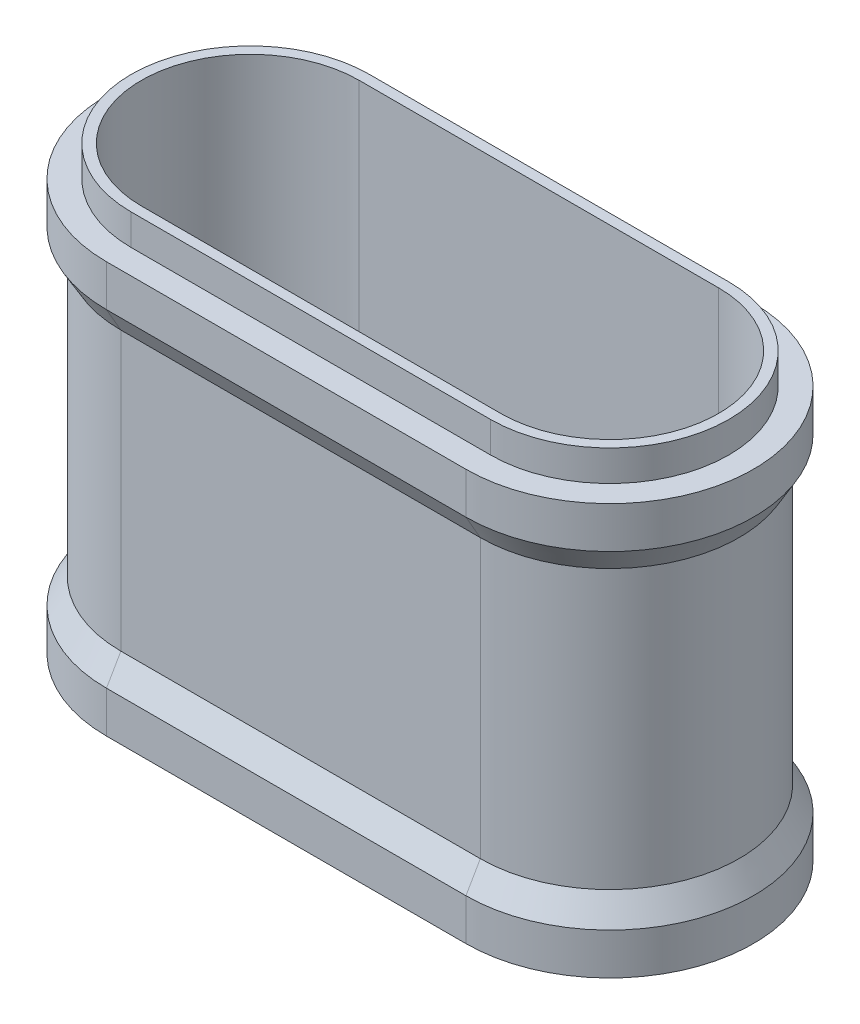
from build123d import *

# Parameters (mm, degrees)
BOSS_EXTRUDE1_DEPTH      = 10
BOSS_EXTRUDE1_DEPTH_BACK = 10
BOSS_EXTRUDE2_START      = -1.5
BOSS_EXTRUDE2_DEPTH      = 1.5
BOSS_EXTRUDE3_DEPTH      = 1.5
CHAMFER1_SIZE            = 1
CHAMFER1_SIZE_2          = 1.732050808


with BuildPart() as part:
    # Sketch1 → Boss-Extrude1 (new, two sides: drawn at the far end of the back side and taken through both)
    with BuildSketch(Plane(origin=(0, 0, 0), x_dir=(1, 0, 0), z_dir=(0, 1, 0)).offset(-BOSS_EXTRUDE1_DEPTH_BACK)):
        with BuildLine():
            Line((-8.75, 6.3), (8.75, 6.3))
            ThreePointArc((8.75, 6.3), (15.05, 0), (8.75, -6.3))
            Line((8.75, -6.3), (-8.75, -6.3))
            ThreePointArc((-8.75, -6.3), (-15.05, 0), (-8.75, 6.3))
        make_face()
        with BuildLine():
            Line((-8.75, 5.3), (8.75, 5.3))
            ThreePointArc((8.75, 5.3), (14.05, 0), (8.75, -5.3))
            Line((8.75, -5.3), (-8.75, -5.3))
            ThreePointArc((-8.75, -5.3), (-14.05, 0), (-8.75, 5.3))
        make_face(mode=Mode.SUBTRACT)
    extrude(amount=BOSS_EXTRUDE1_DEPTH + BOSS_EXTRUDE1_DEPTH_BACK)

    # Sketch2 → Boss-Extrude2 (add)
    with BuildSketch(Plane(origin=(0, 10, 0), x_dir=(1, 0, 0), z_dir=(0, 1, 0)).offset(BOSS_EXTRUDE2_START)):
        with BuildLine():
            Line((8.75, -7), (-8.75, -7))
            ThreePointArc((-8.75, -7), (-15.75, 0), (-8.75, 7))
            Line((-8.75, 7), (8.75, 7))
            ThreePointArc((8.75, 7), (15.75, 0), (8.75, -7))
        make_face()
        with BuildLine():
            Line((-8.75, -5.3), (8.75, -5.3))
            ThreePointArc((8.75, -5.3), (14.05, 0), (8.75, 5.3))
            Line((8.75, 5.3), (-8.75, 5.3))
            ThreePointArc((-8.75, 5.3), (-14.05, 0), (-8.75, -5.3))
        make_face(mode=Mode.SUBTRACT)
    boss_extrude2 = extrude(amount=BOSS_EXTRUDE2_DEPTH)

    # Mirror1: Boss-Extrude2 across plane
    add(boss_extrude2.mirror(Plane.ZX))

    # Sketch3 → Boss-Extrude3 (add)
    with BuildSketch(Plane(origin=(0, 10, 0), x_dir=(1, 0, 0), z_dir=(0, 1, 0))):
        with BuildLine():
            Line((-8.75, -5.8), (8.75, -5.8))
            ThreePointArc((8.75, -5.8), (14.55, 0), (8.75, 5.8))
            Line((8.75, 5.8), (-8.75, 5.8))
            ThreePointArc((-8.75, 5.8), (-14.55, 0), (-8.75, -5.8))
        make_face()
        with BuildLine():
            Line((-8.75, -5.3), (8.75, -5.3))
            ThreePointArc((8.75, -5.3), (14.05, 0), (8.75, 5.3))
            Line((8.75, 5.3), (-8.75, 5.3))
            ThreePointArc((-8.75, 5.3), (-14.05, 0), (-8.75, -5.3))
        make_face(mode=Mode.SUBTRACT)
    extrude(amount=BOSS_EXTRUDE3_DEPTH)

    # Chamfer1
    # the kernel refuses this chamfer: 1.732050808, 1 mm, written as the material it adds along each edge
    with BuildSketch(Plane(origin=(8.75, -8.5, 0), x_dir=(0, 0, -1), z_dir=(-1, 0, 0))) as chamfer1_piece_1_section:
        Polygon((6.3 + CHAMFER1_SIZE, 0), (6.3, -CHAMFER1_SIZE_2), (6.3, 0), align=None)
    chamfer1_piece_1 = revolve(axis=Axis((8.75, -8.5, 0), (0, -1, 0)), revolution_arc=180, mode=Mode.PRIVATE)
    chamfer1_piece_1 = chamfer1_piece_1 & Plane(origin=(8.75, -7.628425911, 0), x_dir=(0, 0, -1), z_dir=(0, 1, 0)) * Cylinder(7, 30, mode=Mode.PRIVATE)
    add(chamfer1_piece_1)
    with BuildSketch(Plane(origin=(8.75, -8.5, -6.3), x_dir=(0, -0.05789386240267147, -0.9983227437537926), z_dir=(-1, 0, 0))) as chamfer1_piece_2_section:
        Polygon((CHAMFER1_SIZE * 0.998322743754, -CHAMFER1_SIZE * 0.0578938624027), (-CHAMFER1_SIZE_2 * 0.0578938623883, -CHAMFER1_SIZE_2 * 0.998322743505), (0, 0), align=None)
    chamfer1_piece_2 = extrude(amount=17.5, mode=Mode.PRIVATE)
    chamfer1_piece_2 = split(chamfer1_piece_2, bisect_by=Plane(origin=(1.34e-07, -7.886810156, -7), z_dir=(0, 0, 1)), keep=Keep.TOP, mode=Mode.PRIVATE)
    add(chamfer1_piece_2)
    with BuildSketch(Plane(origin=(-8.75, -8.5, 6.3), x_dir=(0, -0.05789386240267147, 0.9983227437537926), z_dir=(1, 0, 0))) as chamfer1_piece_3_section:
        Polygon((CHAMFER1_SIZE * 0.998322743754, -CHAMFER1_SIZE * 0.0578938624027), (-CHAMFER1_SIZE_2 * 0.0578938623883, -CHAMFER1_SIZE_2 * 0.998322743505), (0, 0), align=None)
    chamfer1_piece_3 = extrude(amount=17.5, mode=Mode.PRIVATE)
    chamfer1_piece_3 = split(chamfer1_piece_3, bisect_by=Plane(origin=(-1.34e-07, -7.886810156, 7), z_dir=(0, 0, -1)), keep=Keep.TOP, mode=Mode.PRIVATE)
    add(chamfer1_piece_3)
    with BuildSketch(Plane(origin=(-8.75, -8.5, 0), x_dir=(0, 0, 1), z_dir=(1, 0, 0))) as chamfer1_piece_4_section:
        Polygon((6.3 + CHAMFER1_SIZE, 0), (6.3, -CHAMFER1_SIZE_2), (6.3, 0), align=None)
    chamfer1_piece_4 = revolve(axis=Axis((-8.75, -8.5, 0), (0, -1, 0)), revolution_arc=180, mode=Mode.PRIVATE)
    chamfer1_piece_4 = chamfer1_piece_4 & Plane(origin=(-8.75, -7.628425911, 0), x_dir=(0, 0, 1), z_dir=(0, 1, 0)) * Cylinder(7, 30, mode=Mode.PRIVATE)
    add(chamfer1_piece_4)
    with BuildSketch(Plane(origin=(8.75, 8.5, -6.3), x_dir=(0, -0.9998132206222079, 0.01932676561270069), z_dir=(-1, 0, 0))) as chamfer1_piece_5_section:
        Polygon((CHAMFER1_SIZE_2 * 0.999813220373, -CHAMFER1_SIZE_2 * 0.0193267656079), (-CHAMFER1_SIZE * 0.0193267656127, -CHAMFER1_SIZE * 0.999813220622), (0, 0), align=None)
    chamfer1_piece_5 = extrude(amount=17.5, mode=Mode.PRIVATE)
    chamfer1_piece_5 = split(chamfer1_piece_5, bisect_by=Plane(origin=(7.49146337, 7.814472044, -7), z_dir=(0, 0, 1)), keep=Keep.TOP, mode=Mode.PRIVATE)
    add(chamfer1_piece_5)
    with BuildSketch(Plane(origin=(8.75, 8.5, 0), x_dir=(0, 0, -1), z_dir=(-1, 0, 0))) as chamfer1_piece_6_section:
        Polygon((6.3 + CHAMFER1_SIZE, 0), (6.3, CHAMFER1_SIZE_2), (6.3, 0), align=None)
    chamfer1_piece_6 = revolve(axis=Axis((8.75, 8.5, 0), (0, -1, 0)), revolution_arc=180, mode=Mode.PRIVATE)
    chamfer1_piece_6 = chamfer1_piece_6 & Plane(origin=(8.75, 7.628425911, 0), x_dir=(0, 0, -1), z_dir=(0, -1, 0)) * Cylinder(7, 30, mode=Mode.PRIVATE)
    add(chamfer1_piece_6)
    with BuildSketch(Plane(origin=(-8.75, 8.5, 0), x_dir=(0, 0, 1), z_dir=(1, 0, 0))) as chamfer1_piece_7_section:
        Polygon((6.3 + CHAMFER1_SIZE, 0), (6.3, CHAMFER1_SIZE_2), (6.3, 0), align=None)
    chamfer1_piece_7 = revolve(axis=Axis((-8.75, 8.5, 0), (0, -1, 0)), revolution_arc=180, mode=Mode.PRIVATE)
    chamfer1_piece_7 = chamfer1_piece_7 & Plane(origin=(-8.75, 7.628425911, 0), x_dir=(0, 0, 1), z_dir=(0, -1, 0)) * Cylinder(7, 30, mode=Mode.PRIVATE)
    add(chamfer1_piece_7)
    with BuildSketch(Plane(origin=(-8.75, 8.5, 6.3), x_dir=(0, 0.05789386240267147, 0.9983227437537926), z_dir=(1, 0, 0))) as chamfer1_piece_8_section:
        Polygon((CHAMFER1_SIZE * 0.998322743754, CHAMFER1_SIZE * 0.0578938624027), (-CHAMFER1_SIZE_2 * 0.0578938623883, CHAMFER1_SIZE_2 * 0.998322743505), (0, 0), align=None)
    chamfer1_piece_8 = extrude(amount=17.5, mode=Mode.PRIVATE)
    chamfer1_piece_8 = split(chamfer1_piece_8, bisect_by=Plane(origin=(-1.34e-07, 7.886810156, 7), z_dir=(0, 0, -1)), keep=Keep.TOP, mode=Mode.PRIVATE)
    add(chamfer1_piece_8)


solid = part.part
